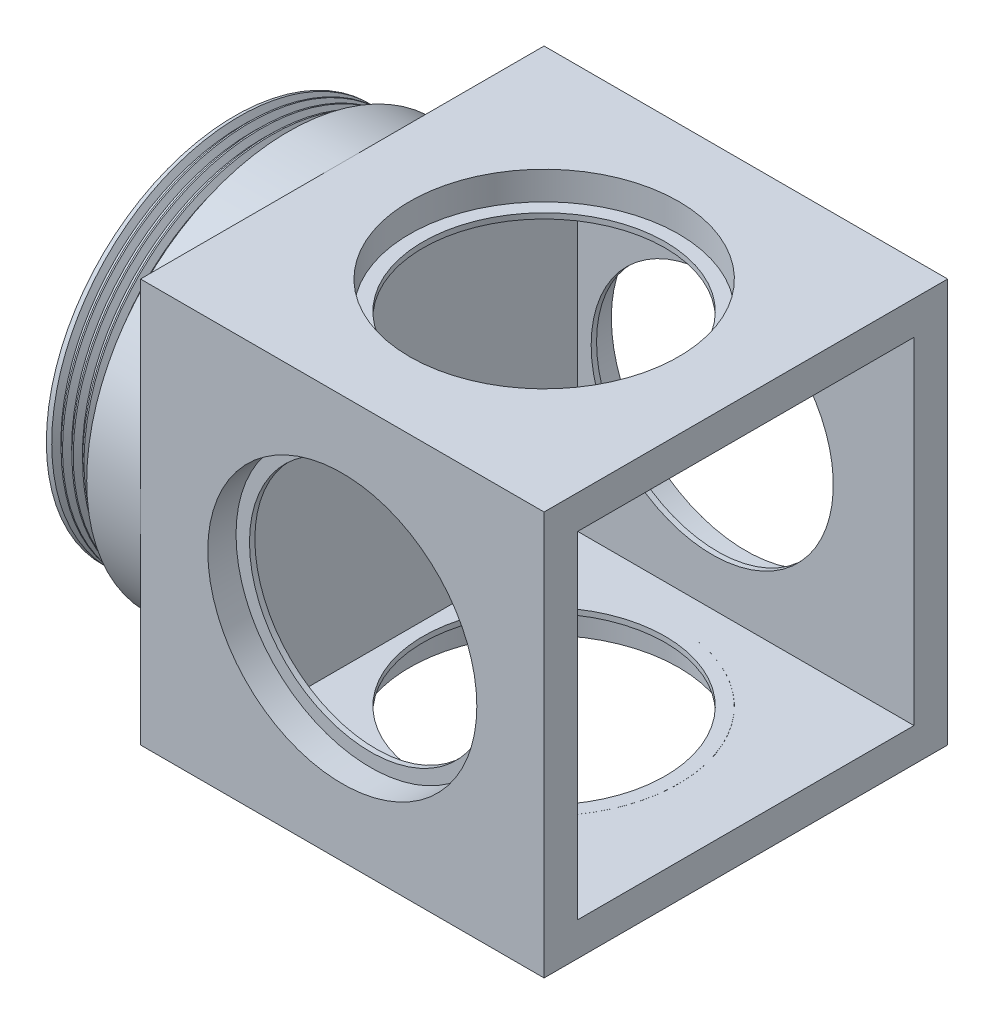
from build123d import *

# Parameters (mm, degrees)
SKETCH1_W           = 75
SKETCH1_H           = 75
SKETCH1_R           = 25
BOSS_EXTRUDE1_DEPTH = 37.5
SKETCH2_R           = 25
CUT_EXTRUDE1_DEPTH  = 75
SKETCH3_W           = 62.5
SKETCH3_H           = 62.5
CUT_EXTRUDE2_DEPTH  = 62.5
SKETCH4_R           = 37.5
BOSS_EXTRUDE2_DEPTH = 10
SKETCH5_R           = 35
SKETCH5_R_2         = 32.5
BOSS_EXTRUDE3_DEPTH = 10
THREAD1_PITCH       = 2
BOSS_EXTRUDE4_START = -6.25
SKETCH6_R           = 25
SKETCH6_R_2         = 22.5
BOSS_EXTRUDE4_DEPTH = 1
BOSS_EXTRUDE5_START = -5.25
SKETCH7_R           = 25
SKETCH7_R_2         = 22.5
BOSS_EXTRUDE5_DEPTH = 1
BOSS_EXTRUDE6_START = -1
SKETCH9_R           = 25
SKETCH9_R_2         = 22.5
BOSS_EXTRUDE6_DEPTH = 1
SKETCH10_R          = 25
SKETCH10_R_2        = 22.5
BOSS_EXTRUDE7_DEPTH = 1


with BuildPart() as part:
    # Sketch1 → Boss-Extrude1 (new, symmetric)
    with BuildSketch(Plane.XY):
        Rectangle(SKETCH1_W, SKETCH1_H)
        Circle(SKETCH1_R, mode=Mode.SUBTRACT)
    extrude(amount=BOSS_EXTRUDE1_DEPTH, both=True)

    # Sketch2 → Cut-Extrude1 (cut)
    with BuildSketch(Plane(origin=(0, 37.5, 0), x_dir=(1, 0, 0), z_dir=(0, 1, 0))):
        with Locations(Location((0.016855244, 0, 0), (0, 0, 270))):
            Circle(SKETCH2_R)
    extrude(amount=-CUT_EXTRUDE1_DEPTH, mode=Mode.SUBTRACT)

    # Sketch3 → Cut-Extrude2 (cut)
    with BuildSketch(Plane(origin=(37.5, 0, 0), x_dir=(0, 0, -1), z_dir=(1, 0, 0))):
        Rectangle(SKETCH3_W, SKETCH3_H)
    extrude(amount=-CUT_EXTRUDE2_DEPTH, mode=Mode.SUBTRACT)

    # Sketch4 → Boss-Extrude2 (add)
    with BuildSketch(Plane.ZY.offset(37.5)):
        Circle(SKETCH4_R)
    extrude(amount=BOSS_EXTRUDE2_DEPTH)

    # Sketch5 → Boss-Extrude3 (add)
    with BuildSketch(Plane.ZY.offset(47.5)):
        Circle(SKETCH5_R)
        Circle(SKETCH5_R_2, mode=Mode.SUBTRACT)
    extrude(amount=BOSS_EXTRUDE3_DEPTH)

    # Thread1: the profile of Thread Profile1 profile screwed along a right-hand helix of 5 turns, 10 arcs to a turn; built about Z, then put on its axis
    thread1_z = Axis((0, 0, 0), (0, 0, 1))
    thread1_corners = [(35.0003, 0, -0.000173205), (35.0003, 0, 1.7501732), (33.91746825, 0, 1.124999997), (33.91746825, 0, 0.624999997)]
    with BuildLine(mode=Mode.PRIVATE) as thread1_profile:
        Line(thread1_corners[0], thread1_corners[1])
        Line(thread1_corners[1], thread1_corners[2])
        Line(thread1_corners[2], thread1_corners[3])
        Line(thread1_corners[3], thread1_corners[0])
    thread1_cap = Face(thread1_profile.wire())
    thread1_turn_angles = [0, 18, 36, 54, 72, 90, 108, 126, 144, 162, 180, 198, 216, 234, 252, 270, 288, 306, 324, 342, 360]
    thread1_turn_weights = [1, 0.9510565162951535, 1, 0.9510565162951535, 1, 0.9510565162951535, 1, 0.9510565162951535, 1, 0.9510565162951535, 1, 0.9510565162951535, 1, 0.9510565162951535, 1, 0.9510565162951535, 1, 0.9510565162951535, 1, 0.9510565162951535, 1]
    thread1_turn_rails = [Edge.make_bspline([Vector(p[0], p[1], 0).rotate(thread1_z, thread1_turn_angles[k]) / thread1_turn_weights[k] + Vector(0, 0, p[2] + THREAD1_PITCH * thread1_turn_angles[k] / 360) for k in range(21)], [0, 0, 0, 1, 1, 2, 2, 3, 3, 4, 4, 5, 5, 6, 6, 7, 7, 8, 8, 9, 9, 10, 10, 10], 2, thread1_turn_weights) for p in thread1_corners]
    thread1_turn_sides = [Face.make_surface_from_curves(thread1_turn_rails[p[0]], thread1_turn_rails[p[1]]) for p in [(0, 1), (1, 2), (2, 3), (3, 0)]]
    thread1 = Plane(origin=(-57.5, 0, 0), x_dir=(0, 0, -1), z_dir=(1, 0, 0)) * Solid(Shell([*[p.moved(Location((0, 0, THREAD1_PITCH * i))) for i in range(5) for p in thread1_turn_sides], thread1_cap, thread1_cap.rotate(thread1_z, 1800).moved(Location((0, 0, THREAD1_PITCH * 1800 / 360)))]))
    add(thread1, mode=Mode.SUBTRACT)

    # Sketch6 → Boss-Extrude4 (add)
    with BuildSketch(Plane(origin=(0, -37.5, 0), x_dir=(-1, 0, 0), z_dir=(0, -1, 0)).offset(BOSS_EXTRUDE4_START)):
        Circle(SKETCH6_R)
        with Locations(Location((0, 0, 0), (0, 0, 90))):
            Circle(SKETCH6_R_2, mode=Mode.SUBTRACT)
    extrude(amount=BOSS_EXTRUDE4_DEPTH)

    # Sketch7 → Boss-Extrude5 (add)
    with BuildSketch(Plane(origin=(0, 0, -37.5), x_dir=(-1, 0, 0), z_dir=(0, 0, -1)).offset(BOSS_EXTRUDE5_START)):
        Circle(SKETCH7_R)
        Circle(SKETCH7_R_2, mode=Mode.SUBTRACT)
    extrude(amount=-BOSS_EXTRUDE5_DEPTH)

    # Sketch9 → Boss-Extrude6 (add)
    with BuildSketch(Plane.XZ.offset(-31.25).offset(BOSS_EXTRUDE6_START)):
        Circle(SKETCH9_R)
        with Locations(Location((0, 0, 0), (0, 0, 270))):
            Circle(SKETCH9_R_2, mode=Mode.SUBTRACT)
    extrude(amount=BOSS_EXTRUDE6_DEPTH)


with BuildPart() as body_2:
    # Sketch10 → Boss-Extrude7 (new body)
    with BuildSketch(Plane(origin=(0, 0, 31.25), x_dir=(-1, 0, 0), z_dir=(0, 0, -1))):
        Circle(SKETCH10_R)
        Circle(SKETCH10_R_2, mode=Mode.SUBTRACT)
    extrude(amount=-BOSS_EXTRUDE7_DEPTH)


solid = Compound([part.part, body_2.part])
